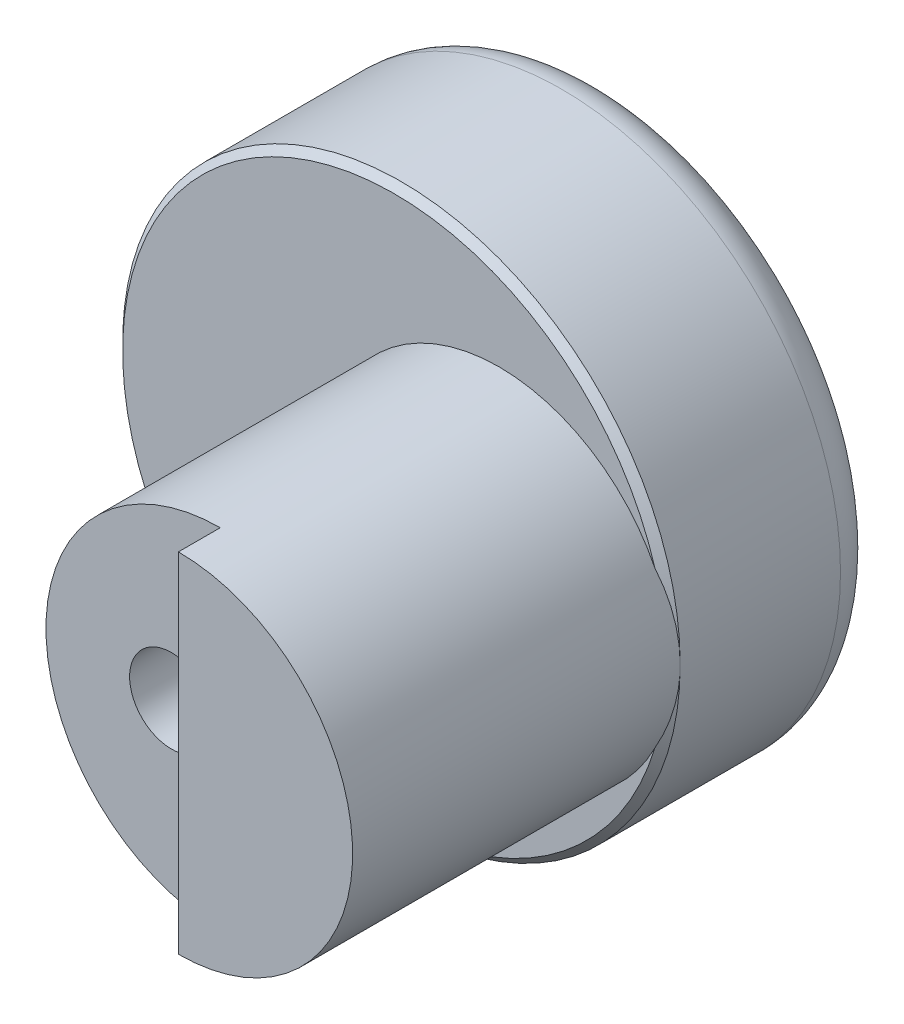
from build123d import *

# Parameters (mm, degrees)
SKETCH1_R           = 20
BOSS_EXTRUDE1_DEPTH = 15
SKETCH2_R           = 12.5
BOSS_EXTRUDE2_DEPTH = 23
SKETCH3_R           = 3
CUT_EXTRUDE1_DEPTH  = 48.370877129
FILLET1_R           = 3
CHAMFER1_SIZE       = 0.5
CUT_EXTRUDE2_DEPTH  = 3


with BuildPart() as part:
    # Sketch1 → Boss-Extrude1 (new body)
    with BuildSketch(Plane.XY):
        Circle(SKETCH1_R)
    extrude(amount=BOSS_EXTRUDE1_DEPTH)

    # Sketch2 → Boss-Extrude2 (add)
    with BuildSketch(Plane.XY.offset(15)):
        with Locations((7.5, 0)):
            Circle(SKETCH2_R)
    extrude(amount=BOSS_EXTRUDE2_DEPTH)

    # Sketch3 → Cut-Extrude1 (cut, through all)
    with BuildSketch(Plane.XY.offset(38)):
        with Locations((4, 0)):
            Circle(SKETCH3_R)
    extrude(amount=-CUT_EXTRUDE1_DEPTH, mode=Mode.SUBTRACT)

    # Fillet1
    fillet1_edges = [part.edges().sort_by_distance(p)[0] for p in [
        (-20, 0, 0),
    ]]
    fillet(fillet1_edges, radius=FILLET1_R)

    # Chamfer1
    # the kernel refuses this chamfer: 0.5 mm, written as the material it takes off along each edge
    with BuildSketch(Plane(origin=(0, 0, 15), x_dir=(1, 0, 0), z_dir=(0, -1, 0))) as chamfer1_piece_1_section:
        Polygon((20, -CHAMFER1_SIZE), (20 - CHAMFER1_SIZE, 0), (20, 0), align=None)
    chamfer1_piece_1 = revolve(axis=Axis((0, 0, 15), (0, 0, 1)), mode=Mode.PRIVATE)
    chamfer1_piece_1 = chamfer1_piece_1 - Plane(origin=(7.5, 0, 14.767938502), x_dir=(1, 0, 0), z_dir=(0, 0, -1)) * Cylinder(12.5, 80, mode=Mode.PRIVATE)
    add(chamfer1_piece_1, mode=Mode.SUBTRACT)

    # Sketch5 → Cut-Extrude2 (cut)
    with BuildSketch(Plane.XY.offset(38)):
        with BuildLine():
            Line((7.5, 12.5), (7.5, -12.5))
            ThreePointArc((7.5, -12.5), (-8.980754986, 0), (7.5, 12.5))
        make_face()
    extrude(amount=-CUT_EXTRUDE2_DEPTH, mode=Mode.SUBTRACT)


solid = part.part
